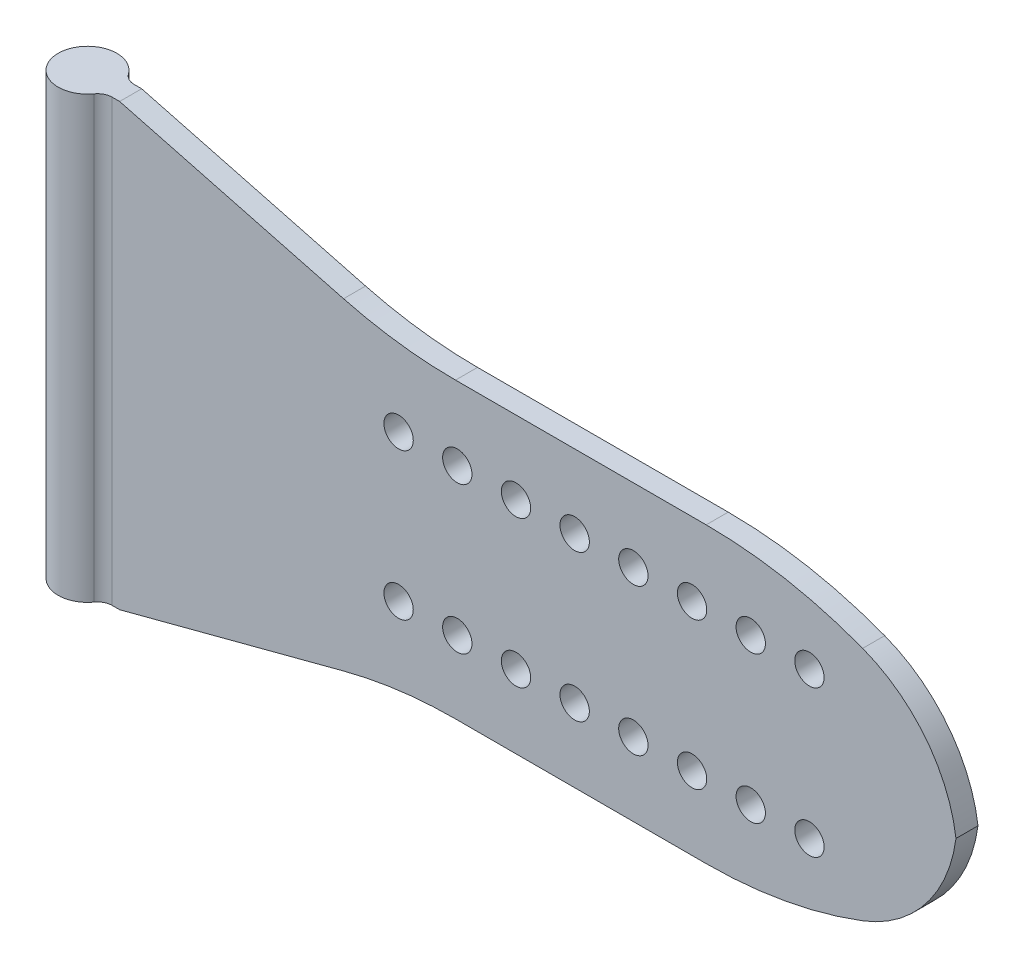
from build123d import *

# Parameters (mm, degrees)
BOSS_EXTRUDE1_DEPTH      = 15
BOSS_EXTRUDE1_DEPTH_BACK = 15
SKETCH2_R                = 1
CUT_EXTRUDE1_DEPTH       = 62.933569598
FILLET1_R                = 30
FILLET2_R                = 10


with BuildPart() as part:
    # Sketch1 → Boss-Extrude1 (new, two sides: drawn at the far end of the back side and taken through both)
    with BuildSketch(Plane(origin=(0, 0, 0), x_dir=(1, 0, 0), z_dir=(0, 1, 0)).offset(-BOSS_EXTRUDE1_DEPTH_BACK)):
        with BuildLine():
            Line((2.436698586, 0.75), (60.026698586, 0.75))
            Line((60.026698586, 0.75), (60.026698586, -0.75))
            Line((60.026698586, -0.75), (2.436698586, -0.75))
            ThreePointArc((2.436698586, -0.75), (1.980263122, -0.860243479), (1.624465724, -1.166666667))
            ThreePointArc((1.624465724, -1.166666667), (-2, 0), (1.624465724, 1.166666667))
            ThreePointArc((1.624465724, 1.166666667), (1.980263122, 0.860243479), (2.436698586, 0.75))
        make_face()
    extrude(amount=BOSS_EXTRUDE1_DEPTH + BOSS_EXTRUDE1_DEPTH_BACK)

    # Sketch2 → Cut-Extrude1 (cut, through all)
    with BuildSketch(Plane.XY.offset(0.75)):
        with Locations((49.952698586, 5)):
            Circle(SKETCH2_R)
        with Locations((45.952698586, 5)):
            Circle(SKETCH2_R)
        with Locations((41.952698586, 5)):
            Circle(SKETCH2_R)
        with Locations((37.952698586, 5)):
            Circle(SKETCH2_R)
        with Locations((33.952698586, 5)):
            Circle(SKETCH2_R)
        with Locations((29.952698586, 5)):
            Circle(SKETCH2_R)
        with Locations((25.952698586, 5)):
            Circle(SKETCH2_R)
        with Locations((21.952698586, 5)):
            Circle(SKETCH2_R)
        with Locations((45.952698586, -5)):
            Circle(SKETCH2_R)
        with Locations((41.952698586, -5)):
            Circle(SKETCH2_R)
        with Locations((37.952698586, -5)):
            Circle(SKETCH2_R)
        with Locations((33.952698586, -5)):
            Circle(SKETCH2_R)
        with Locations((29.952698586, -5)):
            Circle(SKETCH2_R)
        with Locations((25.952698586, -5)):
            Circle(SKETCH2_R)
        with Locations((21.952698586, -5)):
            Circle(SKETCH2_R)
        with Locations((49.952698586, -5)):
            Circle(SKETCH2_R)
        Polygon((49.952698586, 10), (21.952698586, 10), (2.940698586, 15), (60.026698586, 15), (60.026698586, 5), align=None)
        Polygon((49.952698586, -10), (21.952698586, -10), (2.940698586, -15), (60.026698586, -15), (60.026698586, -5), align=None)
    extrude(amount=-CUT_EXTRUDE1_DEPTH, mode=Mode.SUBTRACT)

    # Fillet1
    fillet1_edges = [part.edges().sort_by_distance(p)[0] for p in [
        (49.952698586, 10, 0),
        (21.952698586, 10, 0),
        (49.952698586, -10, 0),
        (21.952698586, -10, 0),
    ]]
    fillet(fillet1_edges, radius=FILLET1_R)

    # Fillet2
    # the kernel refuses this fillet: 10 mm, written as the material it takes off along each edge
    with BuildSketch(Plane(origin=(60.026698586, -5, 18.566207641), x_dir=(-0.9044112472912746, -0.4266618049146664, 0), z_dir=(0, 0, -1))) as fillet2_piece_1:
        with BuildLine():
            CenterArc((6.353468821, 9.970077682), FILLET2_R, 205.255895662, 69.177572528)
            Line((-2.690643652, 5.703459633), (-3.595054899, 5.276797828))
            Line((-3.595054899, 5.276797828), (-0.904411247, -0.426661805))
            Line((-0.904411247, -0.426661805), (-0.019905188, -0.999801872))
            ThreePointArc((-0.019905188, -0.999801872), (4.190379521, -1.083624989), (7.20378448, -0.997007768))
            Line((7.20378448, -0.997007768), (7.126483056, 0))
        make_face()
    extrude(amount=37.132415281, mode=Mode.SUBTRACT)
    with BuildSketch(Plane(origin=(60.026698586, 5, 18.566207641), x_dir=(0, -1, 0), z_dir=(0, 0, -1))) as fillet2_piece_2:
        with BuildLine():
            CenterArc((6.306267918, 10), FILLET2_R, 200.822427472, 69.177572528)
            Line((-3.040598123, 6.44527143), (-3.975284728, 6.089798573))
            ThreePointArc((-3.975284728, 6.089798573), (-2.767917517, 3.327484976), (-0.895739275, -0.444579747))
            Line((-0.895739275, -0.444579747), (0, -1))
            Line((0, -1), (6.306267918, -1))
            Line((6.306267918, -1), (6.306267918, 0))
        make_face()
    extrude(amount=37.132415281, mode=Mode.SUBTRACT)


solid = part.part
